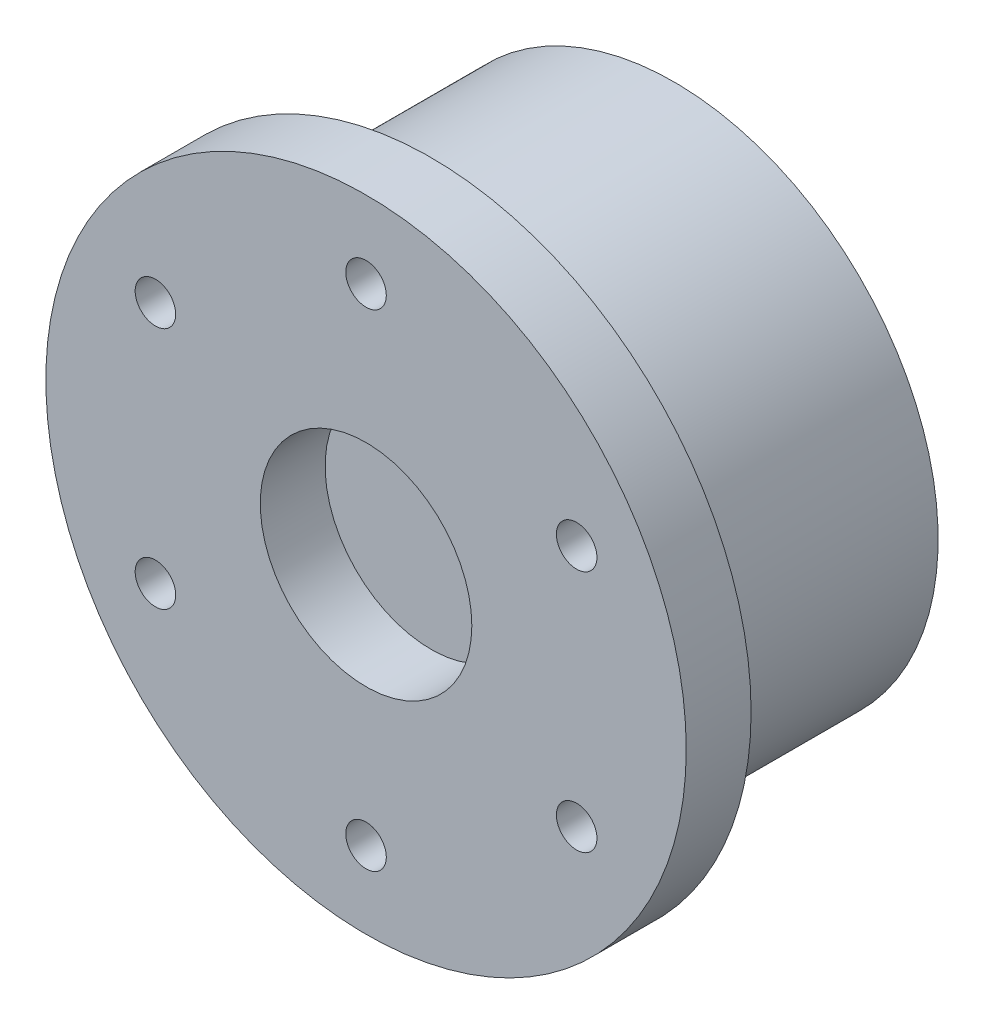
from build123d import *

# Parameters (mm, degrees)
SKETCH1_R           = 39.5
SKETCH1_R_2         = 13.05
BOSS_EXTRUDE1_DEPTH = 8
SKETCH2_R           = 32.575
SKETCH2_R_2         = 2.55
BOSS_EXTRUDE3_DEPTH = 30
SKETCH1_5_R         = 2.5
CUT_EXTRUDE1_DEPTH  = 7


with BuildPart() as part:
    # Sketch1 → Boss-Extrude1 (new body)
    with BuildSketch(Plane.XY):
        Circle(SKETCH1_R)
        Circle(SKETCH1_R_2, mode=Mode.SUBTRACT)
    extrude(amount=-BOSS_EXTRUDE1_DEPTH)

    # Sketch2 → Boss-Extrude3 (add)
    with BuildSketch(Plane(origin=(0, 0, -8), x_dir=(-1, 0, 0), z_dir=(0, 0, -1))):
        Circle(SKETCH2_R)
        with Locations((0, 25)):
            Circle(SKETCH2_R_2, mode=Mode.SUBTRACT)
        with Locations((21.650635095, 12.5)):
            Circle(SKETCH2_R_2, mode=Mode.SUBTRACT)
        with Locations((21.650635095, -12.5)):
            Circle(SKETCH2_R_2, mode=Mode.SUBTRACT)
        with Locations((0, -25)):
            Circle(SKETCH2_R_2, mode=Mode.SUBTRACT)
        with Locations((-21.650635095, -12.5)):
            Circle(SKETCH2_R_2, mode=Mode.SUBTRACT)
        with Locations((-21.650635095, 12.5)):
            Circle(SKETCH2_R_2, mode=Mode.SUBTRACT)
    extrude(amount=BOSS_EXTRUDE3_DEPTH)

    # Sketch1<5> → Cut-Extrude1 (cut)
    with BuildSketch(Plane.XY):
        with Locations((0, 30)):
            Circle(SKETCH1_5_R)
        with Locations((25.980762114, 15)):
            Circle(SKETCH1_5_R)
        with Locations((25.980762114, -15)):
            Circle(SKETCH1_5_R)
        with Locations((0, -30)):
            Circle(SKETCH1_5_R)
        with Locations((-25.980762114, -15)):
            Circle(SKETCH1_5_R)
        with Locations((-25.980762114, 15)):
            Circle(SKETCH1_5_R)
    extrude(amount=-CUT_EXTRUDE1_DEPTH, mode=Mode.SUBTRACT)


solid = part.part
